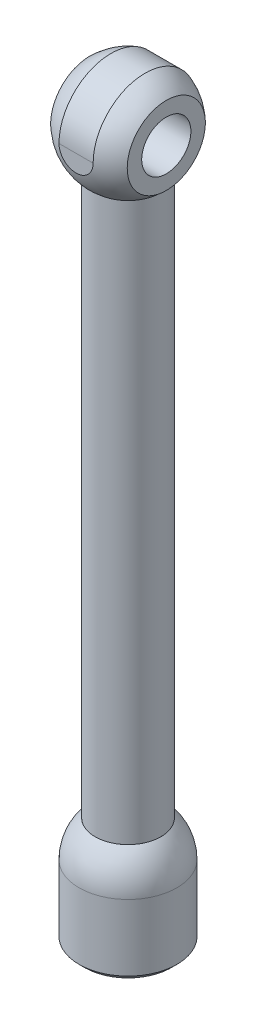
from build123d import *
from build123d.topology import SkipClean

# Parameters (mm, degrees)
CUT_EXTRUDE_1_DEPTH      = 25.494897428
CUT_EXTRUDE_2_DEPTH      = 20.899748742
EXTRUDE_4_DEPTH          = 100
EXTRUDE_4_DEPTH_BACK     = 10
SKETCH_5_R               = 6
CUT_EXTRUDE_3_REACH      = 132.406
CUT_EXTRUDE_3_END_RADIUS = 8.932783894
CHAMFER_2_SIZE           = 1
SKETCH_9_R               = 4.5
CUT_EXTRUDE_4_DEPTH      = 132.071694674


with BuildPart() as part:
    # Эскиз1 → Повернуть1 (revolve)
    with BuildSketch(Plane.XY):
        with BuildLine():
            Line((0, 10), (0, -10))
            ThreePointArc((0, -10), (10, 0), (0, 10))
        make_face()
    revolve(axis=Axis((0, 10, 0), (0, -1, 0)))

    # Эскиз3 → Вырез-Вытянуть1 (cut, through all)
    with SkipClean():  # the faces are left unmerged after this step: merging them gives an invalid solid
        with BuildSketch(Plane(origin=(0, 10, 0), x_dir=(1, 0, 0), z_dir=(0, 1, 0))):
            with BuildLine():
                Line((-7, 7.141428429), (-7, -7.141428429))
                ThreePointArc((-7, -7.141428429), (-10, 0), (-7, 7.141428429))
            make_face()
            with BuildLine():
                Line((7, 7.141428429), (7, -7.141428429))
                ThreePointArc((7, -7.141428429), (10, 0), (7, 7.141428429))
            make_face()
        extrude(amount=-CUT_EXTRUDE_1_DEPTH, mode=Mode.SUBTRACT)

    # Эскиз4 → Вырез-Вытянуть2 (cut, through all)
    with SkipClean():  # the faces are left unmerged after this step: merging them gives an invalid solid
        with BuildSketch(Plane.ZY.offset(7)):
            with BuildLine():
                Line((-9.5, 0), (-9.5, -11.558193376))
                Line((-9.5, -11.558193376), (-11.108111605, -11.558193376))
                Line((-11.108111605, -11.558193376), (-11.108111605, 11.628024295))
                Line((-11.108111605, 11.628024295), (11.340171681, 11.628024295))
                Line((11.340171681, 11.628024295), (11.340171681, -11.558193376))
                Line((11.340171681, -11.558193376), (9.5, -11.558193376))
                Line((9.5, -11.558193376), (9.5, 0))
                ThreePointArc((9.5, 0), (0, 9.5), (-9.5, 0))
            make_face()
        extrude(amount=-CUT_EXTRUDE_2_DEPTH, mode=Mode.SUBTRACT)

    # Эскиз5 → Бобышка-Вытянуть4 (add, two sides: drawn at the far end of the back side and taken through both)
    with SkipClean():  # the faces are left unmerged after this step: merging them gives an invalid solid
        with BuildSketch(Plane(origin=(0, -10, 0), x_dir=(-1, 0, 0), z_dir=(0, -1, 0)).offset(-EXTRUDE_4_DEPTH_BACK)):
            with Locations(Location((0, 0, 0), (0, 0, 90))):
                Circle(SKETCH_5_R)
        extrude(amount=EXTRUDE_4_DEPTH + EXTRUDE_4_DEPTH_BACK)

    # Эскиз9 → Вырез-Вытянуть4 (cut, through all)
    with SkipClean():  # the faces are left unmerged after this step: merging them gives an invalid solid
        with BuildSketch(Plane.ZY.offset(7)):
            Circle(SKETCH_9_R)
        extrude(amount=-CUT_EXTRUDE_4_DEPTH, mode=Mode.SUBTRACT)


with BuildPart() as body_2:
    # Эскиз6 → Повернуть2 (revolve)
    with BuildSketch(Plane.XY, mode=Mode.PRIVATE) as revolve_2_sk:
        with BuildLine():
            Line((0, -110), (0, -129.752400891))
            Line((0, -129.752400891), (-8.932783894, -129.752400891))
            Line((-8.932783894, -129.752400891), (-8.932783894, -116.617750985))
            ThreePointArc((-8.932783894, -116.617750985), (-8.166741439, -112.998502117), (-6, -110))
            Line((-6, -110), (0, -110))
        make_face()
    revolve(revolve_2_sk.sketch.rotate(Axis((0, -110, 0), (0, -1, 0)), 270), axis=Axis((0, -110, 0), (0, -1, 0)))

    # Эскиз7 → Вырез-Повернуть1 (revolve, cut)
    with BuildSketch(Plane(origin=(0, 0, 0), x_dir=(0, 0, -1), z_dir=(1, 0, 0))):
        with BuildLine():
            Line((0, -117.863437075), (0, -131.863437075))
            ThreePointArc((0, -131.863437075), (7, -124.863437075), (0, -117.863437075))
        make_face()
    revolve(axis=Axis((0, -129.752400891, 0), (0, 1, 0)), mode=Mode.SUBTRACT)

    # Вырез-Вытянуть3: up to this cylinder (the profile starts inside it)
    cut_extrude_3_end = Plane(origin=(0, -125.423518, 0), z_dir=(0, 1, 0)) * Cylinder(CUT_EXTRUDE_3_END_RADIUS, 283.677567788, mode=Mode.PRIVATE)
    # Эскиз8 → Вырез-Вытянуть3 (cut, up to the surface)
    with BuildSketch(Plane(origin=(0, 0, 0), x_dir=(0, 0, -1), z_dir=(1, 0, 0)), mode=Mode.PRIVATE) as cut_extrude_3_sk1:
        with BuildLine():
            Line((-4.5, -124.747055334), (-4.5, -129.752400891))
            Line((-4.5, -129.752400891), (4.5, -129.752400891))
            Line((4.5, -129.752400891), (4.5, -124.747055334))
            ThreePointArc((4.5, -124.747055334), (0, -120.247055334), (-4.5, -124.747055334))
        make_face()
    cut_extrude_3_tool1 = extrude(cut_extrude_3_sk1.sketch, amount=-CUT_EXTRUDE_3_REACH, mode=Mode.PRIVATE) & cut_extrude_3_end
    add(cut_extrude_3_tool1.solids().sort_by_distance((0, -125.423518, 0))[0], mode=Mode.SUBTRACT)

    # Фаска2
    # the kernel refuses this chamfer: 1, 0.707159459 mm, written as the material it takes off along each edge
    with BuildSketch(Plane(origin=(0, -129.752400891, 0), x_dir=(-0.8245803433521156, 0, 0.5657448694926958), z_dir=(-0.5657448694926958, 0, -0.8245803433521156))) as chamfer_2_piece_1:
        with BuildLine():
            Line((5.009793689 + CHAMFER_2_SIZE, 0), (5.47833473, 0.531458959))
            ThreePointArc((5.47833473, 0.531458959), (5.251626356, 0.260743789), (5.009793689, 0))
            Line((5.009793689, 0), (5.009793689 + CHAMFER_2_SIZE, 0))
        make_face()
    revolve(axis=Axis((0, -129.752400891, 0), (0, 1, 0)), revolution_arc=235.545967623, mode=Mode.SUBTRACT)
    with BuildSketch(Plane(origin=(0, -129.752400891, 0), x_dir=(-0.971519805459464, 0, -0.23695836680734683), z_dir=(-0.23695836680734683, 0, 0.971519805459464))) as chamfer_2_piece_2:
        Polygon((8.932783894, -CHAMFER_2_SIZE), (8.932783894 - CHAMFER_2_SIZE, 0), (8.932783894, 0), align=None)
    revolve(axis=Axis((0, -129.752400891, 0), (0, -1, 0)), revolution_arc=256.292910039, mode=Mode.SUBTRACT)
    with BuildSketch(Plane(origin=(0, -129.752400891, 0), x_dir=(0, 0, 1), z_dir=(1, 0, 0))) as chamfer_2_piece_3:
        Polygon((8.932783894, -CHAMFER_2_SIZE), (8.932783894 - CHAMFER_2_SIZE, 0), (8.932783894, 0), align=None)
    revolve(axis=Axis((0, -129.752400891, 0), (0, -1, 0)), revolution_arc=76.248727648, mode=Mode.SUBTRACT)
    with BuildSketch(Plane(origin=(0, -129.752400891, 0), x_dir=(0, 0, -1), z_dir=(1, 0, 0))) as chamfer_2_piece_4:
        with BuildLine():
            Line((5.009793689 + CHAMFER_2_SIZE, 0), (5.47833473, 0.531458959))
            ThreePointArc((5.47833473, 0.531458959), (5.251626356, 0.260743789), (5.009793689, 0))
            Line((5.009793689, 0), (5.009793689 + CHAMFER_2_SIZE, 0))
        make_face()
    revolve(axis=Axis((0, -129.752400891, 0), (0, 1, 0)), revolution_arc=55.484942969, mode=Mode.SUBTRACT)


solid = Compound([part.part, body_2.part])
